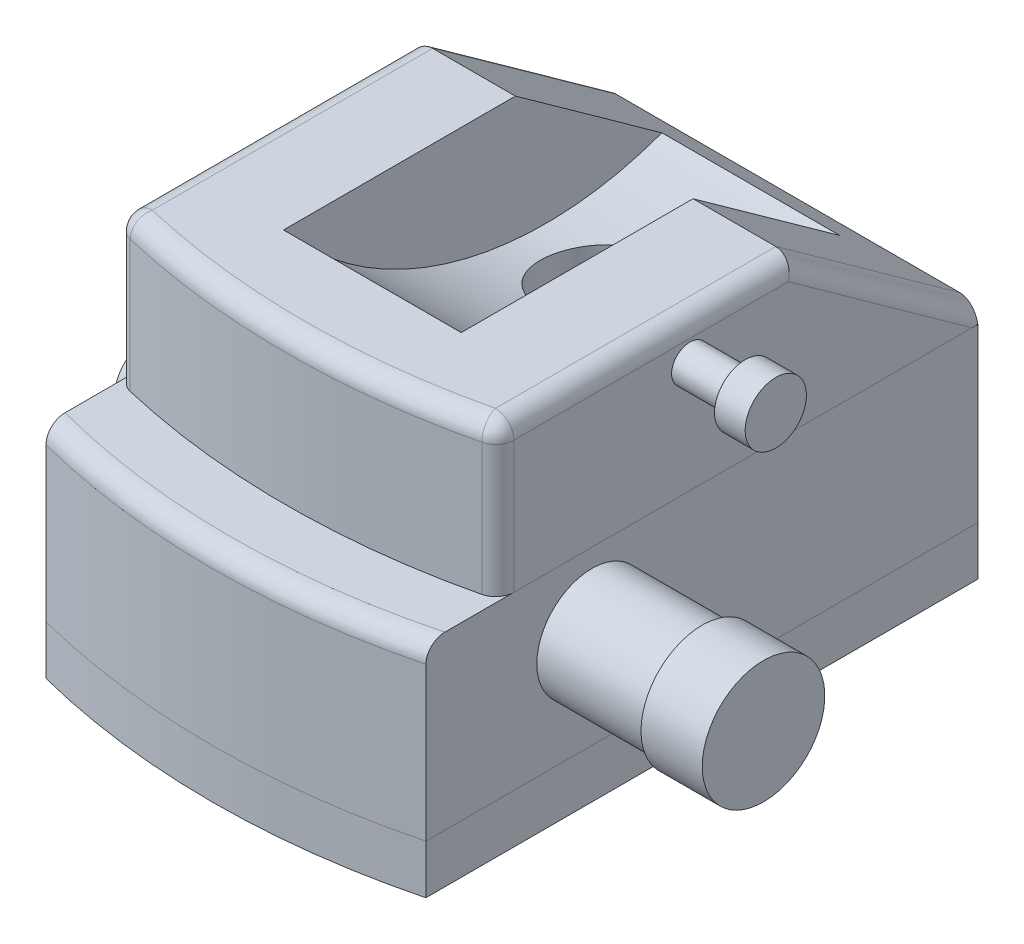
from build123d import *

# Parameters (mm, degrees)
SKIZZE1_W                       = 62
SKIZZE1_H                       = 94
AUFSATZ_LINEAR_AUSTRAGEN1_DEPTH = 8
SCHNITT_LINEAR_START            = -8
SCHNITT_LINEAR_AUSTRAGEN1_DEPTH = 8
AUFSATZ_LINEAR_AUSTRAGEN2_DEPTH = 28
SKIZZE4_W                       = 62
SKIZZE4_H                       = 82
AUFSATZ_LINEAR_AUSTRAGEN3_DEPTH = 24.5
SCHNITT_LINEAR_START_2          = -24.5
SCHNITT_LINEAR_AUSTRAGEN2_DEPTH = 24.5
SCHNITT_LINEAR_AUSTRAGEN3_DEPTH = 32.25
SKIZZE7_R                       = 55
SCHNITT_LINEAR_AUSTRAGEN4_DEPTH = 14.5
VERRUNDUNG1_R                   = 3
VERRUNDUNG2_R                   = 3
SKIZZE12_W                      = 10
SKIZZE12_H                      = 6
SKIZZE14_R                      = 9.5
SCHNITT_LINEAR_AUSTRAGEN5_DEPTH = 97.696690788


# Read off the part's stored shape, not the designer's step: Schnitt-Linear austragen1, Schnitt-Linear austragen2
with BuildPart() as part:
    # Skizze1 → Aufsatz-Linear austragen1 (new body)
    with BuildSketch(Plane(origin=(0, 0, 0), x_dir=(1, 0, 0), z_dir=(0, 1, 0))):
        Rectangle(SKIZZE1_W, SKIZZE1_H)
    extrude(amount=AUFSATZ_LINEAR_AUSTRAGEN1_DEPTH)

    # Schnitt-Linear austragen1 outline → Schnitt-Linear austragen1 (cut)
    with BuildSketch(Plane(origin=(0, 8, 0), x_dir=(1, 0, 0), z_dir=(0, 1, 0)).offset(SCHNITT_LINEAR_START)):
        with BuildLine():
            ThreePointArc((31, -43.095004026), (15.622491747, -46.019908691), (0, -47))
            Line((0, -47), (31, -47))
            Line((31, -47), (31, -43.095004026))
        make_face()
        with BuildLine():
            ThreePointArc((0, -47), (-15.622491747, -46.019908691), (-31, -43.095004026))
            Line((-31, -43.095004026), (-31, -47))
            Line((-31, -47), (0, -47))
        make_face()
    extrude(amount=SCHNITT_LINEAR_AUSTRAGEN1_DEPTH, mode=Mode.SUBTRACT)


with BuildPart() as body_2:
    # Skizze3 → Aufsatz-Linear austragen2 (new body)
    with BuildSketch(Plane(origin=(0, 8, 0), x_dir=(1, 0, 0), z_dir=(0, 1, 0))):
        with BuildLine():
            Line((-31, 47), (-31, -43.095004026))
            ThreePointArc((-31, -43.095004026), (0, -47), (31, -43.095004026))
            Line((31, -43.095004026), (31, 47))
            Line((31, 47), (-31, 47))
        make_face()
    extrude(amount=AUFSATZ_LINEAR_AUSTRAGEN2_DEPTH)

    # Verrundung1
    verrundung1_edges = [body_2.edges().sort_by_distance(p)[0] for p in [
        (0, 36, 47),
    ]]
    fillet(verrundung1_edges, radius=VERRUNDUNG1_R)

    # Skizze11 → Rotation2 (revolve)
    with BuildSketch(Plane.XY.offset(16), mode=Mode.PRIVATE) as rotation2_sk:
        Polygon((31, 24), (31, 33), (49, 33), (49, 34), (59, 34), (59, 24), align=None)
    revolve(rotation2_sk.sketch.rotate(Axis((4.559824511, 24, 16), (1, 0, 0)), 90), axis=Axis((4.559824511, 24, 16), (1, 0, 0)))

    # Skizze12 → Rotation3 (revolve)
    with BuildSketch(Plane.XY.offset(16), mode=Mode.PRIVATE) as rotation3_sk:
        with Locations((-36, 27)):
            Rectangle(SKIZZE12_W, SKIZZE12_H)
    revolve(rotation3_sk.sketch.rotate(Axis((-5.61653293, 24, 16), (-1, 0, 0)), 90), axis=Axis((-5.61653293, 24, 16), (-1, 0, 0)))


with BuildPart() as body_3:
    # Skizze4 → Aufsatz-Linear austragen3 (new body)
    with BuildSketch(Plane(origin=(0, 36, 0), x_dir=(1, 0, 0), z_dir=(0, 1, 0))):
        with Locations((0, 6)):
            Rectangle(SKIZZE4_W, SKIZZE4_H)
    extrude(amount=AUFSATZ_LINEAR_AUSTRAGEN3_DEPTH)

    # Schnitt-Linear austragen2 outline → Schnitt-Linear austragen2 (cut)
    with BuildSketch(Plane(origin=(0, 60.5, 0), x_dir=(1, 0, 0), z_dir=(0, 1, 0)).offset(SCHNITT_LINEAR_START_2)):
        with BuildLine():
            ThreePointArc((31, -31.095004026), (15.622491747, -34.019908691), (0, -35))
            Line((0, -35), (31, -35))
            Line((31, -35), (31, -31.095004026))
        make_face()
        with BuildLine():
            ThreePointArc((0, -35), (-15.622491747, -34.019908691), (-31, -31.095004026))
            Line((-31, -31.095004026), (-31, -35))
            Line((-31, -35), (0, -35))
        make_face()
    extrude(amount=SCHNITT_LINEAR_AUSTRAGEN2_DEPTH, mode=Mode.SUBTRACT)

    # Skizze6 → Schnitt-Linear austragen3 (cut, symmetric)
    with BuildSketch(Plane(origin=(0, 0, 0), x_dir=(0, 0, -1), z_dir=(1, 0, 0))):
        Polygon((47, 60.5), (17, 60.5), (47, 39), align=None)
    extrude(amount=SCHNITT_LINEAR_AUSTRAGEN3_DEPTH, both=True, mode=Mode.SUBTRACT)

    # Skizze7 → Schnitt-Linear austragen4 (cut, symmetric)
    with BuildSketch(Plane(origin=(0, 0, 0), x_dir=(0, 0, -1), z_dir=(1, 0, 0))):
        with Locations((22, 95)):
            Circle(SKIZZE7_R)
    extrude(amount=SCHNITT_LINEAR_AUSTRAGEN4_DEPTH, both=True, mode=Mode.SUBTRACT)

    # Verrundung2
    verrundung2_edges = [body_3.edges().sort_by_distance(p)[0] for p in [
        (-31, 49.75, -32),
        (31, 49.75, -32),
        (31, 60.5, 7.047502013),
        (-15.622491747, 60.5, 34.019908691),
        (-31, 60.5, 7.047502013),
        (-31, 48.25, 31.095004026),
        (31, 48.25, 31.095004026),
    ]]
    fillet(verrundung2_edges, radius=VERRUNDUNG2_R)

    # Skizze10 → Rotation1 (revolve)
    with BuildSketch(Plane.XY, mode=Mode.PRIVATE) as rotation1_sk:
        Polygon((31, 54), (31, 57), (40, 57), (40, 59), (45, 59), (45, 54), align=None)
    revolve(rotation1_sk.sketch.rotate(Axis((12.139432052, 54, 0), (1, 0, 0)), 90), axis=Axis((12.139432052, 54, 0), (1, 0, 0)))


with BuildPart() as schnitt_linear_austragen5_tool:
    # Skizze14 → Schnitt-Linear austragen5 (new, through all)
    with BuildSketch(Plane.XZ):
        with Locations(Location((0, -17, 0), (0, 0, 270))):
            Circle(SKIZZE14_R)
    extrude(amount=-SCHNITT_LINEAR_AUSTRAGEN5_DEPTH)


with BuildPart() as part_1:
    add(part.part)

    # Schnitt-Linear austragen5: cut by schnitt_linear_austragen5_tool
    add(schnitt_linear_austragen5_tool.part, mode=Mode.SUBTRACT)


with BuildPart() as body_2_1:
    add(body_2.part)

    # Schnitt-Linear austragen5: cut by schnitt_linear_austragen5_tool
    add(schnitt_linear_austragen5_tool.part, mode=Mode.SUBTRACT)


with BuildPart() as body_3_1:
    add(body_3.part)

    # Schnitt-Linear austragen5: cut by schnitt_linear_austragen5_tool
    add(schnitt_linear_austragen5_tool.part, mode=Mode.SUBTRACT)


solid = Compound([part_1.part, body_2_1.part, body_3_1.part])
